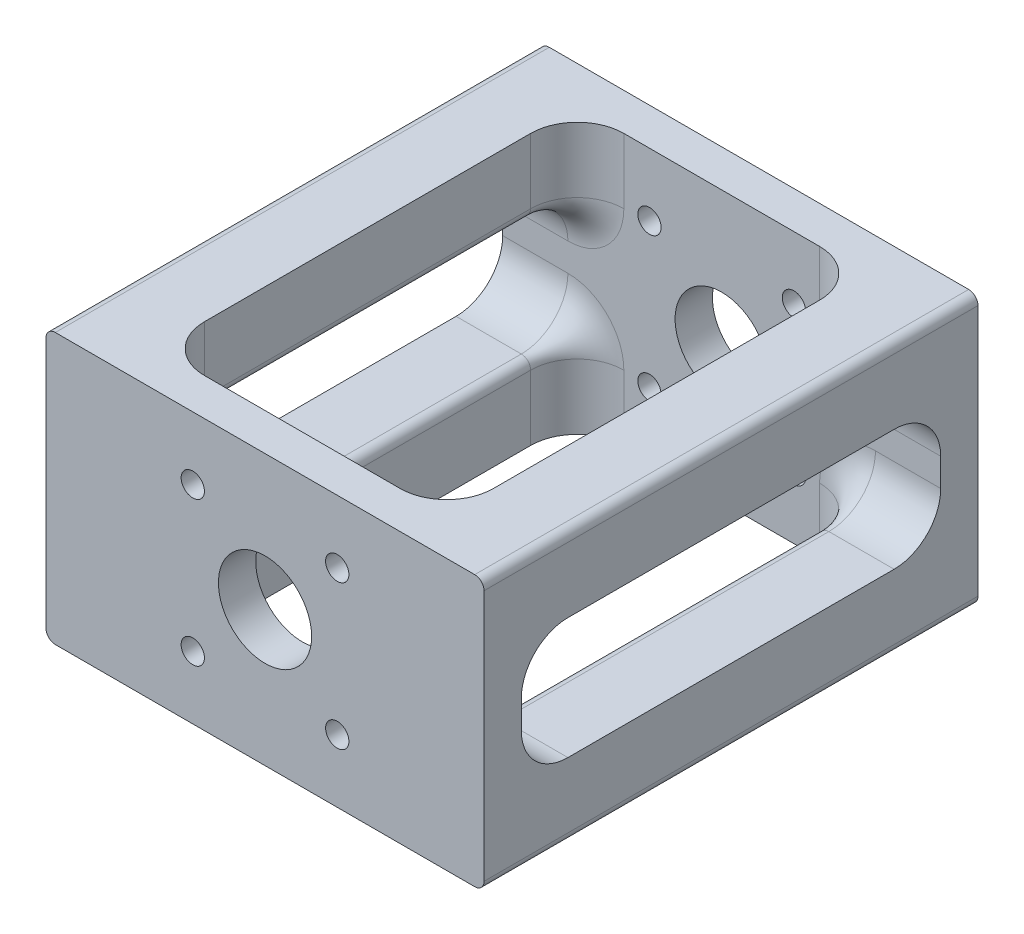
from build123d import *

# Parameters (mm, degrees)
SKETCH1_W            = 47
SKETCH1_H            = 29
SKETCH1_R            = 1.25
SKETCH1_R_2          = 5
BOSS_EXTRUDE1_DEPTH  = 4
SKETCH3_W            = 8
SKETCH3_H            = 8
BOSS_EXTRUDE2_DEPTH  = 22.5
FILLET1_R            = 1
FILLET2_R            = 5
FILLET1_OF_MIRROR3_R = 1
FILLET2_OF_MIRROR3_R = 5


with BuildPart() as part:
    # Sketch1 → Boss-Extrude1 (new body)
    with BuildSketch(Plane.XY):
        Rectangle(SKETCH1_W, SKETCH1_H)
        with Locations((7.75, -7.75)):
            Circle(SKETCH1_R, mode=Mode.SUBTRACT)
        with Locations((7.75, 7.75)):
            Circle(SKETCH1_R, mode=Mode.SUBTRACT)
        with Locations((-7.75, 7.75)):
            Circle(SKETCH1_R, mode=Mode.SUBTRACT)
        Circle(SKETCH1_R_2, mode=Mode.SUBTRACT)
        with Locations((-7.75, -7.75)):
            Circle(SKETCH1_R, mode=Mode.SUBTRACT)
    boss_extrude1 = extrude(amount=-BOSS_EXTRUDE1_DEPTH)

    # Sketch3 → Boss-Extrude2 (add)
    with BuildSketch(Plane(origin=(0, 0, -4), x_dir=(-1, 0, 0), z_dir=(0, 0, -1))):
        with Locations((19.5, -10.5)):
            Rectangle(SKETCH3_W, SKETCH3_H)
        with Locations((-19.5, -10.5)):
            Rectangle(SKETCH3_W, SKETCH3_H)
        with Locations((-19.5, 10.5)):
            Rectangle(SKETCH3_W, SKETCH3_H)
        with Locations((19.5, 10.5)):
            Rectangle(SKETCH3_W, SKETCH3_H)
    boss_extrude2 = extrude(amount=BOSS_EXTRUDE2_DEPTH)

    # Fillet1
    fillet1_edges = [part.edges().sort_by_distance(p)[0] for p in [
        (15.5, 6.5, -15.25),
        (-15.5, 6.5, -15.25),
        (-15.5, -6.5, -15.25),
        (15.5, -6.5, -15.25),
        (23.5, -14.5, -13.25),
        (23.5, 14.5, -13.25),
        (-23.5, 14.5, -13.25),
        (-23.5, -14.5, -13.25),
    ]]
    fillet(fillet1_edges, radius=FILLET1_R)

    # Fillet2
    fillet2_edges = [part.edges().sort_by_distance(p)[0] for p in [
        (15.5, -11, -4),
        (15.792893219, -6.792893219, -4),
        (-15.5, -11, -4),
        (-15.792893219, -6.792893219, -4),
        (-15.5, 11, -4),
        (-15.792893219, 6.792893219, -4),
        (15.5, 11, -4),
        (15.792893219, 6.792893219, -4),
        (20, -6.5, -4),
        (-20, -6.5, -4),
        (-20, 6.5, -4),
        (20, 6.5, -4),
    ]]
    fillet(fillet2_edges, radius=FILLET2_R)

    # Mirror3: Boss-Extrude1, Boss-Extrude2 across plane
    add(boss_extrude1.mirror(Plane.XY.offset(-26.5)))
    add(boss_extrude2.mirror(Plane.XY.offset(-26.5)))

    # Fillet1 of Mirror3
    fillet1_of_mirror3_edges = [part.edges().sort_by_distance(p)[0] for p in [
        (15.5, 6.5, -37.75),
        (-15.5, 6.5, -37.75),
        (-15.5, -6.5, -37.75),
        (15.5, -6.5, -37.75),
        (23.5, -14.5, -39.75),
        (23.5, 14.5, -39.75),
        (-23.5, 14.5, -39.75),
        (-23.5, -14.5, -39.75),
    ]]
    fillet(fillet1_of_mirror3_edges, radius=FILLET1_OF_MIRROR3_R)

    # Fillet2 of Mirror3
    fillet2_of_mirror3_edges = [part.edges().sort_by_distance(p)[0] for p in [
        (15.5, -11, -49),
        (15.792893219, -6.792893219, -49),
        (-15.5, -11, -49),
        (-15.792893219, -6.792893219, -49),
        (-15.5, 11, -49),
        (-15.792893219, 6.792893219, -49),
        (15.5, 11, -49),
        (15.792893219, 6.792893219, -49),
        (20, -6.5, -49),
        (-20, -6.5, -49),
        (-20, 6.5, -49),
        (20, 6.5, -49),
    ]]
    fillet(fillet2_of_mirror3_edges, radius=FILLET2_OF_MIRROR3_R)


solid = part.part
